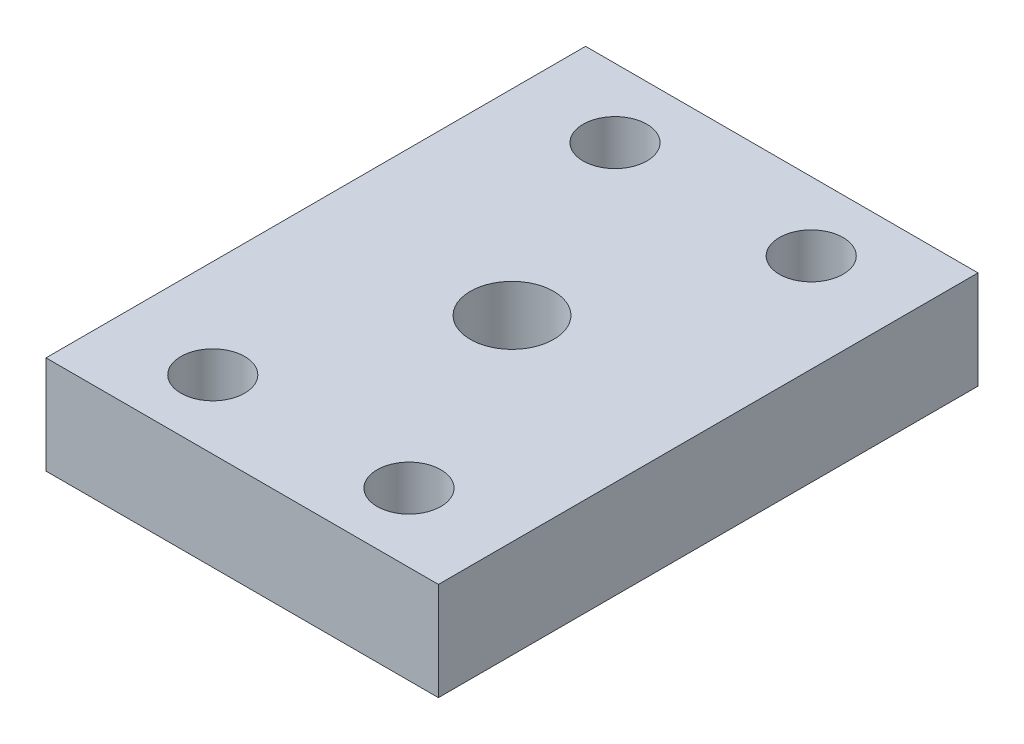
from build123d import *

# Parameters (mm, degrees)
SKETCH1_W           = 40
SKETCH1_H           = 55
BOSS_EXTRUDE1_DEPTH = 10
CUT_EXTRUDE1_REACH  = 43.353
SKETCH2_R           = 4.25
CUT_EXTRUDE3_REACH  = 43.353
SKETCH5_R           = 3.25


with BuildPart() as part:
    # Sketch1 → Boss-Extrude1 (new body)
    with BuildSketch(Plane(origin=(0, 0, 0), x_dir=(1, 0, 0), z_dir=(0, 1, 0))):
        with Locations((-0.91852329, -6.741379093)):
            Rectangle(SKETCH1_W, SKETCH1_H)
    extrude(amount=BOSS_EXTRUDE1_DEPTH)

    # Sketch2 → Cut-Extrude1 (cut, up to next)
    with BuildSketch(Plane.XZ, mode=Mode.PRIVATE) as cut_extrude1_sk1:
        with Locations((-0.91852329, 6.741379093)):
            Circle(SKETCH2_R)
    cut_extrude1_tool1 = extrude(cut_extrude1_sk1.sketch, amount=-CUT_EXTRUDE1_REACH, mode=Mode.PRIVATE) & part.part
    add(cut_extrude1_tool1.solids().sort_by_distance((-0.918523, 0, 6.741379))[0], mode=Mode.SUBTRACT)

    # Sketch5 → Cut-Extrude3 (cut, up to next)
    with BuildSketch(Plane(origin=(0, 10, 0), x_dir=(1, 0, 0), z_dir=(0, 1, 0)), mode=Mode.PRIVATE) as cut_extrude3_sk1:
        with Locations((-10.91852329, -27.241379093)):
            Circle(SKETCH5_R)
    cut_extrude3_tool1 = extrude(cut_extrude3_sk1.sketch, amount=-CUT_EXTRUDE3_REACH, mode=Mode.PRIVATE) & part.part
    # Sketch5 → Cut-Extrude3 (cut, up to next)
    with BuildSketch(Plane(origin=(0, 10, 0), x_dir=(1, 0, 0), z_dir=(0, 1, 0)), mode=Mode.PRIVATE) as cut_extrude3_sk2:
        with Locations((9.08147671, -27.241379093)):
            Circle(SKETCH5_R)
    cut_extrude3_tool2 = extrude(cut_extrude3_sk2.sketch, amount=-CUT_EXTRUDE3_REACH, mode=Mode.PRIVATE) & part.part
    # Sketch5 → Cut-Extrude3 (cut, up to next)
    with BuildSketch(Plane(origin=(0, 10, 0), x_dir=(1, 0, 0), z_dir=(0, 1, 0)), mode=Mode.PRIVATE) as cut_extrude3_sk3:
        with Locations((-10.91852329, 13.758620907)):
            Circle(SKETCH5_R)
    cut_extrude3_tool3 = extrude(cut_extrude3_sk3.sketch, amount=-CUT_EXTRUDE3_REACH, mode=Mode.PRIVATE) & part.part
    # Sketch5 → Cut-Extrude3 (cut, up to next)
    with BuildSketch(Plane(origin=(0, 10, 0), x_dir=(1, 0, 0), z_dir=(0, 1, 0)), mode=Mode.PRIVATE) as cut_extrude3_sk4:
        with Locations((9.08147671, 13.758620907)):
            Circle(SKETCH5_R)
    cut_extrude3_tool4 = extrude(cut_extrude3_sk4.sketch, amount=-CUT_EXTRUDE3_REACH, mode=Mode.PRIVATE) & part.part
    add(cut_extrude3_tool1.solids().sort_by_distance((-10.918523, 10, 27.241379))[0], mode=Mode.SUBTRACT)
    add(cut_extrude3_tool2.solids().sort_by_distance((9.081477, 10, 27.241379))[0], mode=Mode.SUBTRACT)
    add(cut_extrude3_tool3.solids().sort_by_distance((-10.918523, 10, -13.758621))[0], mode=Mode.SUBTRACT)
    add(cut_extrude3_tool4.solids().sort_by_distance((9.081477, 10, -13.758621))[0], mode=Mode.SUBTRACT)


solid = part.part
